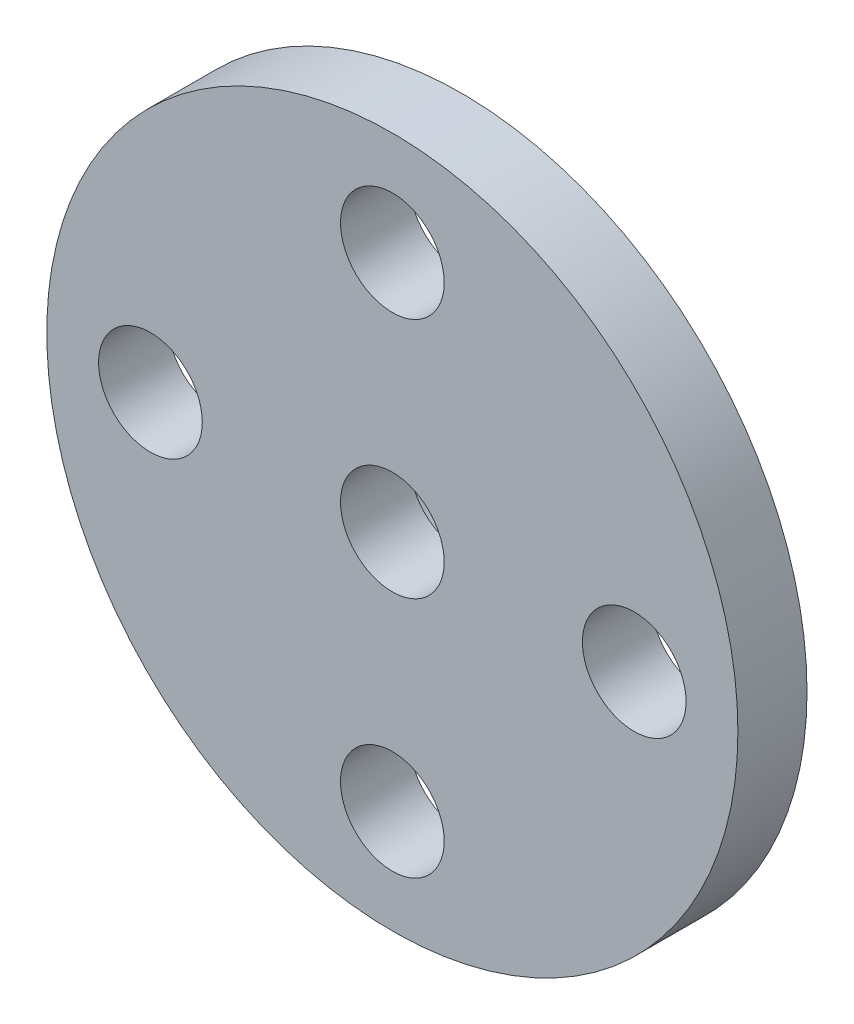
from build123d import *

# Parameters (mm, degrees)
SKETCH_1_R      = 10
SKETCH_1_R_2    = 1.5
EXTRUDE_1_DEPTH = 2
SKETCH_2_R      = 4.5
SKETCH_2_R_2    = 3
EXTRUDE_2_DEPTH = 2


with BuildPart() as part:
    # 草图1 → 凸台-拉伸1 (new body)
    with BuildSketch(Plane.XY):
        Circle(SKETCH_1_R)
        Circle(SKETCH_1_R_2, mode=Mode.SUBTRACT)
        with Locations((0, 7)):
            Circle(SKETCH_1_R_2, mode=Mode.SUBTRACT)
        with Locations((7, 0)):
            Circle(SKETCH_1_R_2, mode=Mode.SUBTRACT)
        with Locations((0, -7)):
            Circle(SKETCH_1_R_2, mode=Mode.SUBTRACT)
        with Locations((-7, 0)):
            Circle(SKETCH_1_R_2, mode=Mode.SUBTRACT)
    extrude(amount=EXTRUDE_1_DEPTH)

    # 草图2 → 凸台-拉伸2 (add)
    with BuildSketch(Plane(origin=(0, 0, 0), x_dir=(-1, 0, 0), z_dir=(0, 0, -1))):
        Circle(SKETCH_2_R)
        Circle(SKETCH_2_R_2, mode=Mode.SUBTRACT)
    extrude(amount=EXTRUDE_2_DEPTH)


solid = part.part
